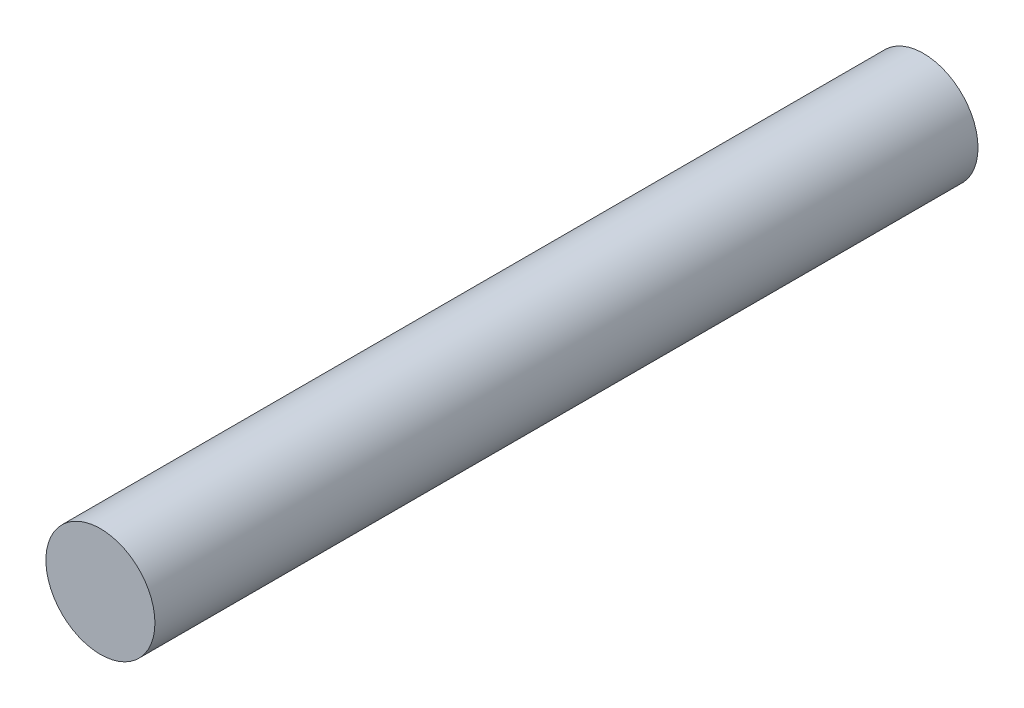
from build123d import *

# Parameters (mm, degrees)
SKETCH1_R           = 2.54
BOSS_EXTRUDE1_DEPTH = 38.35


with BuildPart() as part:
    # Sketch1 → Boss-Extrude1 (new body)
    with BuildSketch(Plane.XY):
        Circle(SKETCH1_R)
    extrude(amount=BOSS_EXTRUDE1_DEPTH)


solid = part.part
